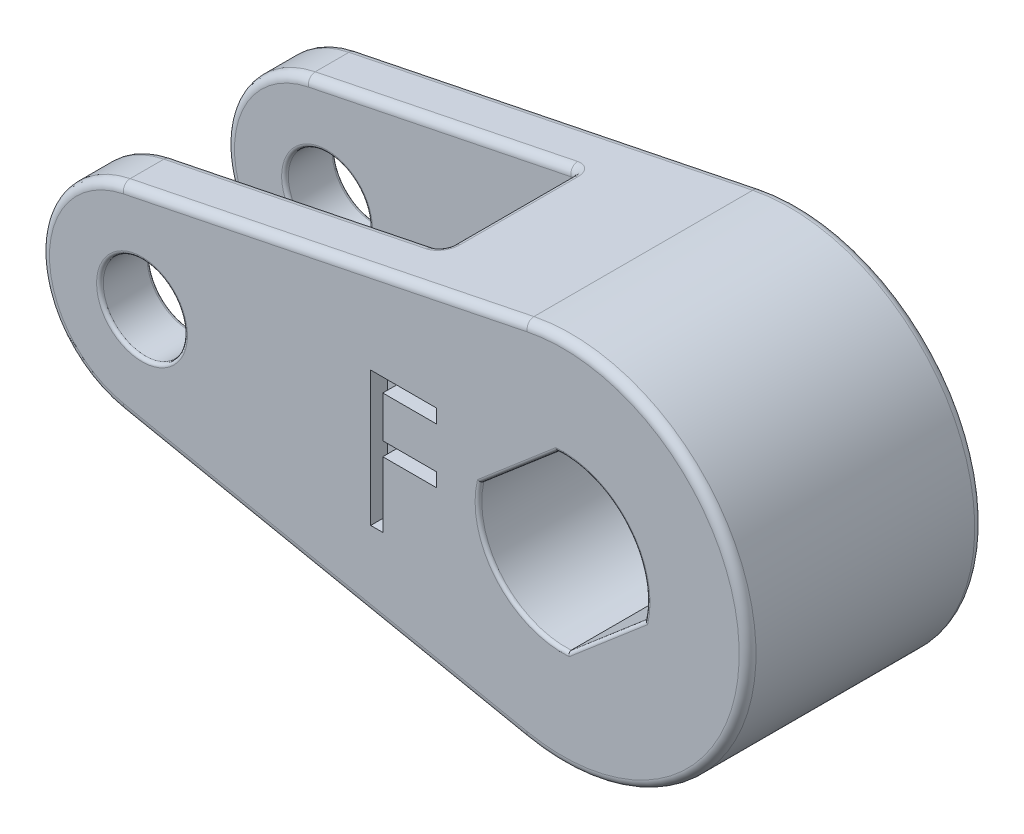
from build123d import *

# Parameters (mm, degrees)
EXTRUDE1_DEPTH     = 14
SKETCH2_R          = 2.5
CUT_EXTRUDE1_DEPTH = 36.749125863
CUT_EXTRUDE3_START = -10
SKETCH6_W          = 8
SKETCH6_H          = 26
CUT_EXTRUDE3_DEPTH = 26.749125863
FILLET1_R          = 0.5
FILLET2_R          = 0.2
CUT_EXTRUDE4_DEPTH = 1
CUT_EXTRUDE5_DEPTH = 1


with BuildPart() as part:
    # Sketch1 → Extrude1 (new body)
    with BuildSketch(Plane.XY):
        with BuildLine():
            Line((-26.2, 5.878775383), (-2.2, 10.777754868))
            ThreePointArc((-2.2, 10.777754868), (11, 0), (-2.2, -10.777754868))
            Line((-2.2, -10.777754868), (-26.2, -5.878775383))
            ThreePointArc((-26.2, -5.878775383), (-31, 0), (-26.2, 5.878775383))
        make_face()
    extrude(amount=EXTRUDE1_DEPTH)

    # Sketch2 → Cut-Extrude1 (cut, through all)
    with BuildSketch(Plane.XY.offset(14)):
        with Locations((-25, 0)):
            Circle(SKETCH2_R)
        with BuildLine():
            Line((-4.87901009, 1.093279717), (-0.316574297, 4.989968007))
            ThreePointArc((-0.316574297, 4.989968007), (3.802029828, 3.247240242), (4.87901009, -1.093279717))
            Line((4.87901009, -1.093279717), (0.316574297, -4.989968007))
            ThreePointArc((0.316574297, -4.989968007), (-3.802029828, -3.247240242), (-4.87901009, 1.093279717))
        make_face()
    extrude(amount=-CUT_EXTRUDE1_DEPTH, mode=Mode.SUBTRACT)

    # Sketch6 → Cut-Extrude3 (cut, through all)
    with BuildSketch(Plane(origin=(0, 0, 0), x_dir=(0, 0, -1), z_dir=(1, 0, 0)).offset(CUT_EXTRUDE3_START)):
        with Locations((-7, 0)):
            Rectangle(SKETCH6_W, SKETCH6_H)
    extrude(amount=-CUT_EXTRUDE3_DEPTH, mode=Mode.SUBTRACT)

    # Fillet1
    fillet1_edges = [part.edges().sort_by_distance(p)[0] for p in [
        (-31, 0, 14),
        (-14.2, -8.328265125, 14),
        (-10, -9.185586535, 7),
        (-10, 0, 3),
        (-10, 9.185586535, 7),
        (-10, 0, 11),
        (11, 0, 14),
        (-18.1, 7.532180959, 11),
        (-31, 0, 11),
        (-18.1, -7.532180959, 11),
        (-14.2, -8.328265125, 0),
        (-31, 0, 3),
        (-18.1, 7.532180959, 3),
        (-18.1, -7.532180959, 3),
        (-31, 0, 0),
        (-14.2, 8.328265125, 0),
        (11, 0, 0),
        (-14.2, 8.328265125, 14),
    ]]
    fillet(fillet1_edges, radius=FILLET1_R)

    # Fillet2
    fillet2_edges = [part.edges().sort_by_distance(p)[0] for p in [
        (3.802029828, 3.247240242, 0),
        (2.597792193, -3.041623862, 0),
        (-3.802029828, -3.247240242, 0),
        (-2.597792193, 3.041623862, 0),
        (3.802029828, 3.247240242, 14),
        (-2.597792193, 3.041623862, 14),
        (-3.802029828, -3.247240242, 14),
        (2.597792193, -3.041623862, 14),
        (-27.5, 0, 0),
        (-27.5, 0, 14),
        (-27.5, 0, 11),
        (-27.5, 0, 3),
    ]]
    fillet(fillet2_edges, radius=FILLET2_R)

    # Sketch8 → Cut-Extrude4 (cut)
    with BuildSketch(Plane.XY.offset(14)):
        Polygon((-11.404205042, 3.671136938), (-7.506769145, 3.671136938), (-7.506769145, 2.850624117), (-10.686256324, 2.850624117), (-10.686256324, 0.389085656), (-7.506769145, 0.389085656), (-7.506769145, -0.431427165), (-10.686256324, -0.431427165), (-10.686256324, -4.328863062), (-11.404205042, -4.328863062), align=None)
    extrude(amount=-CUT_EXTRUDE4_DEPTH, mode=Mode.SUBTRACT)

    # Sketch9 → Cut-Extrude5 (cut)
    with BuildSketch(Plane(origin=(0, 0, 0), x_dir=(-1, 0, 0), z_dir=(0, 0, -1))):
        Polygon((9.18826145, 3.689402697), (13.085697347, 3.689402697), (13.085697347, 2.868889877), (9.906210167, 2.868889877), (9.906210167, 0.407351415), (13.085697347, 0.407351415), (13.085697347, -0.413161405), (9.906210167, -0.413161405), (9.906210167, -4.310597303), (9.18826145, -4.310597303), align=None)
    extrude(amount=-CUT_EXTRUDE5_DEPTH, mode=Mode.SUBTRACT)


solid = part.part
